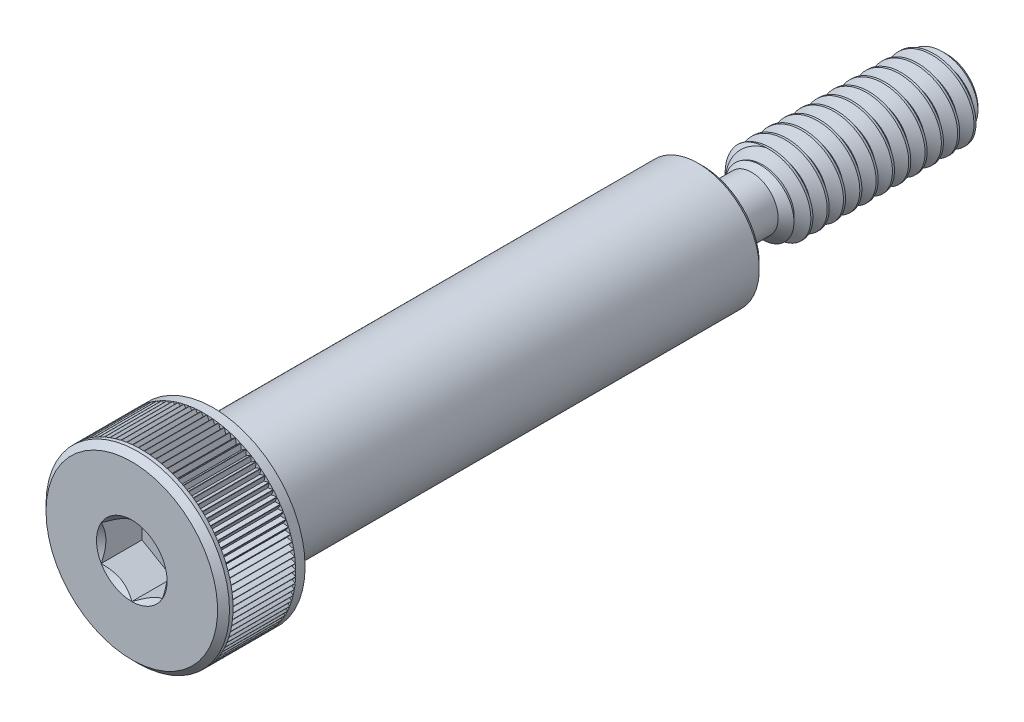
from build123d import *

# Parameters (mm, degrees)
SKETCH12_R          = 3.175
BOSS_EXTRUDE1_DEPTH = 19.05
CHAMFER1_SIZE       = 0.79375
CHAMFER2_SIZE       = 0.46434375
FILLET1_R           = 0.3175
CUT_EXTRUDE2_DEPTH  = 3.175
CUT_SWEEP1_PITCH    = 1.27
SKETCH14_R          = 1.5875
BOSS_EXTRUDE2_DEPTH = 17.145
CUT_EXTRUDE5_DEPTH  = 2.439590625
CIRPATTERN1_COUNT   = 99


with BuildPart() as part:
    # Sketch13 → Revolve1 (revolve)
    with BuildSketch(Plane(origin=(0, 0, 0), x_dir=(0, 0, -1), z_dir=(1, 0, 0)), mode=Mode.PRIVATE) as revolve1_sk:
        Polygon((0, 0), (0, 7.14375), (6.35, 7.14375), (6.35, 4.4053125), (7.62, 4.4053125), (7.9771875, 4.7625), (44.0928125, 4.7625), (44.45, 4.4053125), (44.45, 0), align=None)
    revolve(revolve1_sk.sketch.rotate(Axis((0, 0, -44.45), (0, 0, 1)), 90), axis=Axis((0, 0, -44.45), (0, 0, 1)))

    # Sketch12 → Boss-Extrude1 (add)
    with BuildSketch(Plane(origin=(0, 0, -44.45), x_dir=(-1, 0, 0), z_dir=(0, 0, -1))):
        Circle(SKETCH12_R)
    extrude(amount=BOSS_EXTRUDE1_DEPTH)

    # Sketch5 → Cut-Revolve1 (revolve, cut)
    with BuildSketch(Plane(origin=(0, 0, 0), x_dir=(0, 0, -1), z_dir=(1, 0, 0))):
        Polygon((44.45, 3.175), (49.37125, 3.175), (48.26, 2.06375), (44.45, 2.06375), align=None)
    revolve(axis=Axis((0, 0, -44.45), (0, 0, 1)), mode=Mode.SUBTRACT)

    # Chamfer1
    chamfer1_edges = [part.edges().sort_by_distance(p)[0] for p in [
        (3.175, 0, -63.5),
    ]]
    chamfer(chamfer1_edges, length=CHAMFER1_SIZE)

    # Chamfer2
    chamfer2_edges = [part.edges().sort_by_distance(p)[0] for p in [
        (7.14375, 0, 0),
    ]]
    chamfer(chamfer2_edges, length=CHAMFER2_SIZE)

    # Fillet1
    fillet1_edges = [part.edges().sort_by_distance(p)[0] for p in [
        (0, -2.06375, -44.45),
    ]]
    fillet(fillet1_edges, radius=FILLET1_R)

    # Sketch8 → Cut-Extrude2 (cut)
    with BuildSketch(Plane.XY):
        Polygon((2.38125, 1.374815329), (0, 2.749630657), (-2.38125, 1.374815329), (-2.38125, -1.374815329), (0, -2.749630657), (2.38125, -1.374815329), align=None)
    extrude(amount=-CUT_EXTRUDE2_DEPTH, mode=Mode.SUBTRACT)

    # Cut-Extrude4 cone 1 section (through the dimple's axis) → Cut-Extrude4 (revolve, cut)
    with BuildSketch(Plane(origin=(0, 0, 0), x_dir=(0, -1, 0), z_dir=(1, 0, 0))):
        Polygon((0, 0), (2.749630657, 0), (0, 2.749630657), align=None)
    revolve(axis=Axis((0, 0, 0), (0, 0, -1)), mode=Mode.SUBTRACT)


with BuildPart() as body_2:
    # Split1: the piece on the far side of the plane
    add(part.part)
    split(bisect_by=Plane.XY.offset(-44.45), keep=Keep.BOTTOM)

    # Cut-Sweep1: the profile of Sketch4 screwed along a right-hand helix of 14 turns, 8 arcs to a turn; built about Z, then put on its axis
    cut_sweep1_z = Axis((0, 0, 0), (0, 0, 1))
    cut_sweep1_corners = [(2.350110803, 0, -0.47625), (2.350110803, 0, -0.635), (3.243740766, 0, -1.1509375), (3.243740766, 0, -0.555625), (3.243740766, 0, 0.0396875)]
    with BuildLine(mode=Mode.PRIVATE) as cut_sweep1_profile:
        Line(cut_sweep1_corners[0], cut_sweep1_corners[1])
        Line(cut_sweep1_corners[1], cut_sweep1_corners[2])
        Line(cut_sweep1_corners[2], cut_sweep1_corners[3])
        Line(cut_sweep1_corners[3], cut_sweep1_corners[4])
        Line(cut_sweep1_corners[4], cut_sweep1_corners[0])
    cut_sweep1_cap = Face(cut_sweep1_profile.wire())
    cut_sweep1_turn_angles = [0, 22.5, 45, 67.5, 90, 112.5, 135, 157.5, 180, 202.5, 225, 247.5, 270, 292.5, 315, 337.5, 360]
    cut_sweep1_turn_weights = [1, 0.9238795325112867, 1, 0.9238795325112867, 1, 0.9238795325112867, 1, 0.9238795325112867, 1, 0.9238795325112867, 1, 0.9238795325112867, 1, 0.9238795325112867, 1, 0.9238795325112867, 1]
    cut_sweep1_turn_rails = [Edge.make_bspline([Vector(p[0], p[1], 0).rotate(cut_sweep1_z, cut_sweep1_turn_angles[k]) / cut_sweep1_turn_weights[k] + Vector(0, 0, p[2] + CUT_SWEEP1_PITCH * cut_sweep1_turn_angles[k] / 360) for k in range(17)], [0, 0, 0, 1, 1, 2, 2, 3, 3, 4, 4, 5, 5, 6, 6, 7, 7, 8, 8, 8], 2, cut_sweep1_turn_weights) for p in cut_sweep1_corners]
    cut_sweep1_turn_sides = [Face.make_surface_from_curves(cut_sweep1_turn_rails[p[0]], cut_sweep1_turn_rails[p[1]]) for p in [(0, 1), (1, 2), (2, 3), (3, 4), (4, 0)]]
    cut_sweep1 = Plane(origin=(0, 0, -63.5), x_dir=(0, 1, 0), z_dir=(0, 0, 1)) * Solid(Shell([*[p.moved(Location((0, 0, CUT_SWEEP1_PITCH * i))) for i in range(14) for p in cut_sweep1_turn_sides], cut_sweep1_cap, cut_sweep1_cap.rotate(cut_sweep1_z, 5040).moved(Location((0, 0, CUT_SWEEP1_PITCH * 5040 / 360)))]))
    add(cut_sweep1, mode=Mode.SUBTRACT)


with BuildPart() as part_1:
    add(part.part)

    # Split1
    split(bisect_by=Plane.XY.offset(-44.45), keep=Keep.TOP)

    add(body_2.part)  # Boss-Extrude2 merges body 2
    # Sketch14 → Boss-Extrude2 (add)
    with BuildSketch(Plane(origin=(0, 0, -44.45), x_dir=(-1, 0, 0), z_dir=(0, 0, -1))):
        Circle(SKETCH14_R)
    extrude(amount=BOSS_EXTRUDE2_DEPTH)

    # Sketch11 → Cut-Extrude5 (cut, symmetric)
    with BuildSketch(Plane.XY.offset(-3.175)):
        Polygon((0, 6.772275), (0.214471191, 7.14375), (-0.214471191, 7.14375), align=None)
    cut_extrude5 = extrude(amount=CUT_EXTRUDE5_DEPTH, both=True, mode=Mode.SUBTRACT)

    # CirPattern1: Cut-Extrude5 ×99 about axis
    cirpattern1_axis = Axis((0, 0, 0), (0, 0, 1))
    for i in range(1, CIRPATTERN1_COUNT):
        add(cut_extrude5.rotate(cirpattern1_axis, i * 360 / CIRPATTERN1_COUNT), mode=Mode.SUBTRACT)


solid = part_1.part
